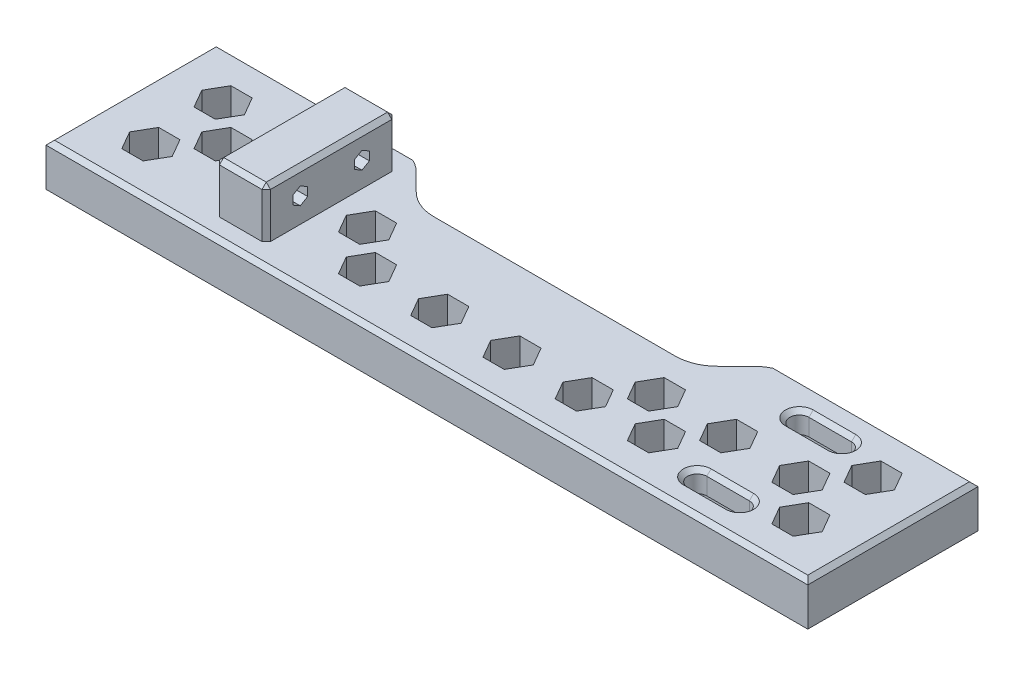
from build123d import *

# Parameters (mm, degrees)
ESQUISSE1_W                     = 179
ESQUISSE1_H                     = 40
BOSS_EXTRU_1_DEPTH              = 10
ESQUISSE2_W                     = 12
ESQUISSE2_H                     = 11.6
BOSS_EXTRU_2_DEPTH              = 15.25
ENL_V_MAT_EXTRU_1_DEPTH         = 12
ENL_V_MAT_EXTRU_2_DEPTH         = 93.438141479
CHANFREIN1_SIZE                 = 1
ENL_V_MAT_EXTRU_3_DEPTH         = 93.438141479
CONG_1_R                        = 10
ENL_V_MAT_EXTRU_4_DEPTH         = 95.2168244
R_P_TITION_DANS_UNE_ZONE1_DEPTH = 20.70303038
ENL_V_MAT_EXTRU_5_DEPTH         = 5


# Read off the part's stored shape, not the designer's step: Répétition dans une zone1
with BuildPart() as part:
    # Esquisse1 → Boss.-Extru.1 (new body)
    with BuildSketch(Plane(origin=(0, 0, 0), x_dir=(1, 0, 0), z_dir=(0, 1, 0))):
        Rectangle(ESQUISSE1_W, ESQUISSE1_H)
    extrude(amount=BOSS_EXTRU_1_DEPTH)

    # Esquisse2 → Boss.-Extru.2 (add, symmetric)
    with BuildSketch(Plane.XY):
        with Locations((-48.5, 15.8)):
            Rectangle(ESQUISSE2_W, ESQUISSE2_H)
    extrude(amount=BOSS_EXTRU_2_DEPTH, both=True)

    # Esquisse3 → Enlèv. mat.-Extru.1 (cut)
    with BuildSketch(Plane.ZY.offset(54.5)):
        Polygon((7.25, 13.779274058), (9, 14.789637029), (9, 16.810362971), (7.25, 17.820725942), (5.5, 16.810362971), (5.5, 14.789637029), align=None)
        Polygon((-5.5, 14.789637029), (-7.25, 13.779274058), (-9, 14.789637029), (-9, 16.810362971), (-7.25, 17.820725942), (-5.5, 16.810362971), align=None)
    extrude(amount=-ENL_V_MAT_EXTRU_1_DEPTH, mode=Mode.SUBTRACT)

    # Esquisse4 → Enlèv. mat.-Extru.2 (cut, through all)
    with BuildSketch(Plane(origin=(0, 10, 0), x_dir=(1, 0, 0), z_dir=(0, 1, 0))):
        with BuildLine():
            Line((55.52, 14.25), (65.52, 14.25))
            ThreePointArc((65.52, 14.25), (67.77, 12), (65.52, 9.75))
            Line((65.52, 9.75), (55.52, 9.75))
            ThreePointArc((55.52, 9.75), (53.27, 12), (55.52, 14.25))
        make_face()
        with BuildLine():
            Line((55.52, -9.75), (65.52, -9.75))
            ThreePointArc((65.52, -9.75), (67.77, -12), (65.52, -14.25))
            Line((65.52, -14.25), (55.52, -14.25))
            ThreePointArc((55.52, -14.25), (53.27, -12), (55.52, -9.75))
        make_face()
    extrude(amount=-ENL_V_MAT_EXTRU_2_DEPTH, mode=Mode.SUBTRACT)

    # Chanfrein1
    chanfrein1_edges = [part.edges().sort_by_distance(p)[0] for p in [
        (-89.5, 10, 0),
        (-54.5, 15.8, -15.25),
        (-48.5, 21.6, -15.25),
        (-54.5, 21.6, 0),
        (-42.5, 15.8, -15.25),
        (0, 10, 20),
        (-42.5, 21.6, 0),
        (-54.5, 15.8, 15.25),
        (-42.5, 15.8, 15.25),
        (-48.5, 21.6, 15.25),
        (89.5, 10, 0),
        (53.27, 10, -12),
        (60.52, 10, -9.75),
        (67.77, 10, -12),
        (60.52, 10, -14.25),
        (53.27, 10, 12),
        (60.52, 10, 14.25),
        (67.77, 10, 12),
        (60.52, 10, 9.75),
        (0, 10, -20),
    ]]
    chamfer(chanfrein1_edges, length=CHANFREIN1_SIZE)

    # Esquisse5 → Enlèv. mat.-Extru.3 (cut, through all)
    with BuildSketch(Plane(origin=(0, 10, 0), x_dir=(1, 0, 0), z_dir=(0, 1, 0))):
        Polygon((-42.5, 20), (-32.5, 10), (32.5, 10), (42.5, 20), align=None)
    extrude(amount=-ENL_V_MAT_EXTRU_3_DEPTH, mode=Mode.SUBTRACT)

    # Congé1
    cong_1_edges = [part.edges().sort_by_distance(p)[0] for p in [
        (42.5, 4.5, -20),
        (32.5, 5, -10),
        (-32.5, 5, -10),
        (-42.5, 4.5, -20),
    ]]
    fillet(cong_1_edges, radius=CONG_1_R)

    # Esquisse8 → Enlèv. mat.-Extru.4 (cut, through all)
    with BuildSketch(Plane.XZ):
        Polygon((-74.176456896, -7.754570801), (-75.619832569, -5.254570801), (-78.506583915, -5.254570801), (-79.949959588, -7.754570801), (-78.506583915, -10.254570801), (-75.619832569, -10.254570801), align=None)
    extrude(amount=-ENL_V_MAT_EXTRU_4_DEPTH, mode=Mode.SUBTRACT)

    # Répétition dans une zone1 outline → Répétition dans une zone1 (cut)
    # profile 1 of 15: a face of its own
    with BuildSketch(Plane(origin=(0, 0, 0), x_dir=(1, 0, 0), z_dir=(0, 1, 0))):
        Polygon((-54.39696962, 8.485281374), (-54.5, 8.663735228), (-56.89696962, 12.815408393), (-61.89696962, 12.815408393), (-64.39696962, 8.485281374), (-61.89696962, 4.155154355), (-56.89696962, 4.155154355), (-54.5, 8.306827521), align=None)
    # profile 2 of 15: a face of its own
    with BuildSketch(Plane(origin=(0, 0, 0), x_dir=(1, 0, 0), z_dir=(0, 1, 0))):
        Polygon((73.867532368, 4.155154355), (78.867532368, 4.155154355), (81.367532368, 8.485281374), (78.867532368, 12.815408393), (73.867532368, 12.815408393), (71.367532368, 8.485281374), align=None)
    # profile 3 of 15: a face of its own
    with BuildSketch(Plane(origin=(0, 0, 0), x_dir=(1, 0, 0), z_dir=(0, 1, 0))):
        Polygon((-78.867532368, 4.155154355), (-73.867532368, 4.155154355), (-71.367532368, 8.485281374), (-73.867532368, 12.815408393), (-78.867532368, 12.815408393), (-81.367532368, 8.485281374), align=None)
        Polygon((-75.619832569, 10.254570801), (-74.176456896, 7.754570801), (-75.619832569, 5.254570801), (-78.506583915, 5.254570801), (-79.949959588, 7.754570801), (-78.506583915, 10.254570801), align=None, mode=Mode.SUBTRACT)
    # profile 4 of 15: a face of its own
    with BuildSketch(Plane(origin=(0, 0, 0), x_dir=(1, 0, 0), z_dir=(0, 1, 0))):
        Polygon((-73.867532368, -12.815408393), (-71.367532368, -8.485281374), (-73.867532368, -4.155154355), (-78.867532368, -4.155154355), (-81.367532368, -8.485281374), (-78.867532368, -12.815408393), align=None)
    # profile 5 of 15: a face of its own
    with BuildSketch(Plane(origin=(0, 0, 0), x_dir=(1, 0, 0), z_dir=(0, 1, 0))):
        Polygon((39.926406871, -12.815408393), (44.926406871, -12.815408393), (47.426406871, -8.485281374), (44.926406871, -4.155154355), (39.926406871, -4.155154355), (37.426406871, -8.485281374), align=None)
    # profile 6 of 15: a face of its own
    with BuildSketch(Plane(origin=(0, 0, 0), x_dir=(1, 0, 0), z_dir=(0, 1, 0))):
        Polygon((-27.955844123, -12.815408393), (-22.955844123, -12.815408393), (-20.455844123, -8.485281374), (-22.955844123, -4.155154355), (-27.955844123, -4.155154355), (-30.455844123, -8.485281374), align=None)
    # profile 7 of 15: a face of its own
    with BuildSketch(Plane(origin=(0, 0, 0), x_dir=(1, 0, 0), z_dir=(0, 1, 0))):
        Polygon((73.867532368, -12.815408393), (78.867532368, -12.815408393), (81.367532368, -8.485281374), (78.867532368, -4.155154355), (73.867532368, -4.155154355), (71.367532368, -8.485281374), align=None)
    # profile 8 of 15: a face of its own
    with BuildSketch(Plane(origin=(0, 0, 0), x_dir=(1, 0, 0), z_dir=(0, 1, 0))):
        Polygon((5.985281374, -12.815408393), (10.985281374, -12.815408393), (13.485281374, -8.485281374), (10.985281374, -4.155154355), (5.985281374, -4.155154355), (3.485281374, -8.485281374), align=None)
    # profile 9 of 15: a face of its own
    with BuildSketch(Plane(origin=(0, 0, 0), x_dir=(1, 0, 0), z_dir=(0, 1, 0))):
        Polygon((22.955844123, -12.815408393), (27.955844123, -12.815408393), (30.455844123, -8.485281374), (27.955844123, -4.155154355), (22.955844123, -4.155154355), (20.455844123, -8.485281374), align=None)
    # profile 10 of 15: a face of its own
    with BuildSketch(Plane(origin=(0, 0, 0), x_dir=(1, 0, 0), z_dir=(0, 1, 0))):
        Polygon((-10.985281374, -12.815408393), (-5.985281374, -12.815408393), (-3.485281374, -8.485281374), (-5.985281374, -4.155154355), (-10.985281374, -4.155154355), (-13.485281374, -8.485281374), align=None)
    # profile 11 of 15: a face of its own
    with BuildSketch(Plane(origin=(0, 0, 0), x_dir=(1, 0, 0), z_dir=(0, 1, 0))):
        Polygon((-65.382250994, -4.330127019), (-62.882250994, 0), (-65.382250994, 4.330127019), (-70.382250994, 4.330127019), (-72.882250994, 0), (-70.382250994, -4.330127019), align=None)
    # profile 12 of 15: a face of its own
    with BuildSketch(Plane(origin=(0, 0, 0), x_dir=(1, 0, 0), z_dir=(0, 1, 0))):
        Polygon((65.382250994, -4.330127019), (70.382250994, -4.330127019), (72.882250994, 0), (70.382250994, 4.330127019), (65.382250994, 4.330127019), (62.882250994, 0), align=None)
    # profile 13 of 15: a face of its own
    with BuildSketch(Plane(origin=(0, 0, 0), x_dir=(1, 0, 0), z_dir=(0, 1, 0))):
        Polygon((31.441125497, -4.330127019), (36.441125497, -4.330127019), (38.941125497, 0), (36.441125497, 4.330127019), (31.441125497, 4.330127019), (28.941125497, 0), align=None)
    # profile 14 of 15: a face of its own
    with BuildSketch(Plane(origin=(0, 0, 0), x_dir=(1, 0, 0), z_dir=(0, 1, 0))):
        Polygon((48.411688245, -4.330127019), (53.411688245, -4.330127019), (55.911688245, 0), (53.411688245, 4.330127019), (48.411688245, 4.330127019), (45.911688245, 0), align=None)
    # profile 15 of 15: a face of its own
    with BuildSketch(Plane(origin=(0, 0, 0), x_dir=(1, 0, 0), z_dir=(0, 1, 0))):
        Polygon((-36.441125497, -4.330127019), (-31.441125497, -4.330127019), (-28.941125497, 0), (-31.441125497, 4.330127019), (-36.441125497, 4.330127019), (-38.941125497, 0), align=None)
    extrude(amount=R_P_TITION_DANS_UNE_ZONE1_DEPTH, mode=Mode.SUBTRACT)

    # Esquisse10 → Enlèv. mat.-Extru.5 (cut)
    with BuildSketch(Plane.XZ):
        with BuildLine():
            Line((53.52, 15.5), (67.52, 15.5))
            ThreePointArc((67.52, 15.5), (71.02, 12), (67.52, 8.5))
            Line((67.52, 8.5), (53.52, 8.5))
            ThreePointArc((53.52, 8.5), (50.02, 12), (53.52, 15.5))
        make_face()
        with BuildLine():
            Line((53.52, -8.5), (67.52, -8.5))
            ThreePointArc((67.52, -8.5), (71.02, -12), (67.52, -15.5))
            Line((67.52, -15.5), (53.52, -15.5))
            ThreePointArc((53.52, -15.5), (50.02, -12), (53.52, -8.5))
        make_face()
    extrude(amount=-ENL_V_MAT_EXTRU_5_DEPTH, mode=Mode.SUBTRACT)


solid = part.part
